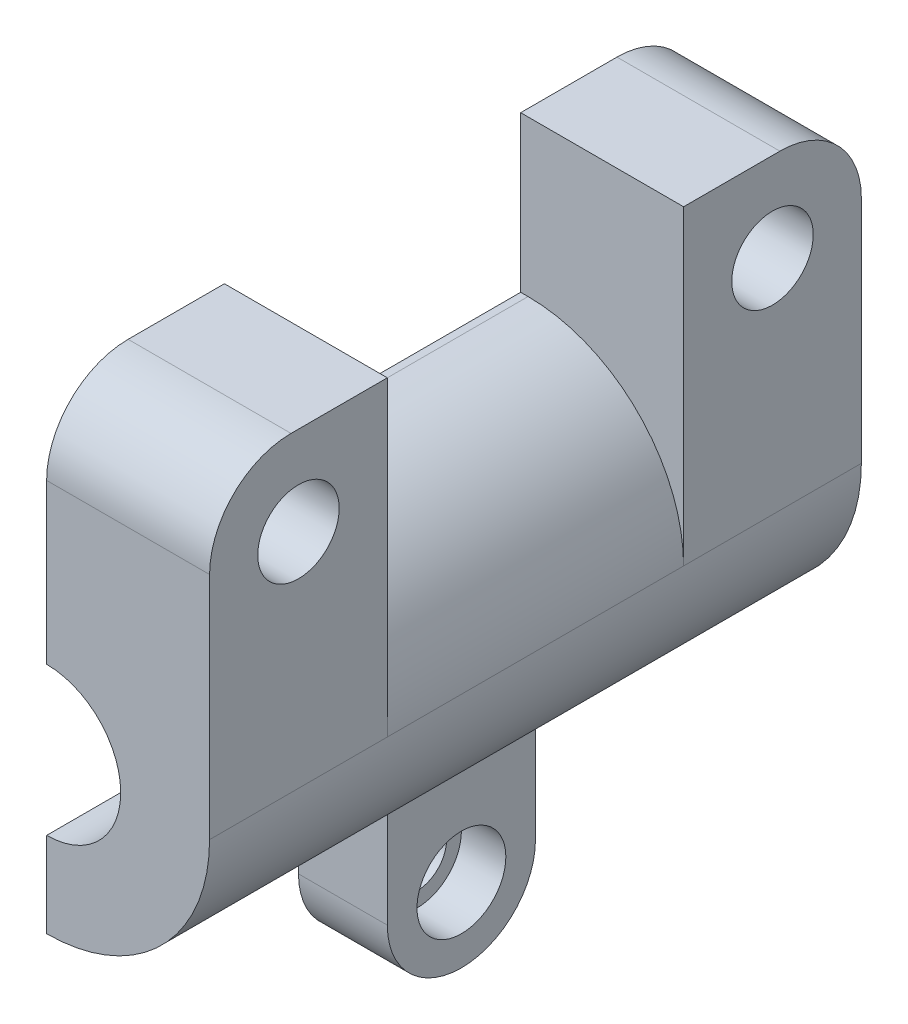
from build123d import *

# Parameters (mm, degrees)
SKETCH1_W               = 44
SKETCH1_H               = 32
BOSS_EXTRUDE1_DEPTH     = 11
SKETCH2_W               = 24.5
SKETCH2_H               = 15.5
CUT_EXTRUDE1_DEPTH      = 7.75
FILLET1_R               = 7.75
CUT_EXTRUDE2_DEPTH      = 40.370833113
CUT_EXTRUDE2_DEPTH_BACK = 40.370833113
SKETCH4_R               = 2.75
SKETCH4_W               = 20
SKETCH4_H               = 10.5
CUT_EXTRUDE3_DEPTH      = 30.342801502
FILLET4_R               = 5.5
SKETCH7_W               = 10
SKETCH7_H               = 10
SKETCH7_R               = 2
BOSS_EXTRUDE5_DEPTH     = 6
FILLET5_R               = 5
CUT_EXTRUDE7_START      = -3
SKETCH9_R               = 3
SKETCH9_R_2             = 2
CUT_EXTRUDE7_DEPTH      = 3
FILLET7_R               = 10.5
FILLET8_R               = 11


# Some blends are built 0.0001 mm under size
with BuildPart() as part:
    # Sketch1 → Boss-Extrude1 (new body)
    with BuildSketch(Plane(origin=(0, 0, 0), x_dir=(0, 0, -1), z_dir=(1, 0, 0))):
        Rectangle(SKETCH1_W, SKETCH1_H)
    extrude(amount=BOSS_EXTRUDE1_DEPTH)

    # Sketch2 → Cut-Extrude1 (cut)
    with BuildSketch(Plane(origin=(0, 0, 0), x_dir=(0, 0, -1), z_dir=(1, 0, 0))):
        with Locations((0, -5.25)):
            Rectangle(SKETCH2_W, SKETCH2_H)
    extrude(amount=CUT_EXTRUDE1_DEPTH, mode=Mode.SUBTRACT)

    # Fillet1
    fillet1_edges = [part.edges().sort_by_distance(p)[0] for p in [
        (7.75, 2.5, 0),
        (7.75, -13, 0),
    ]]
    fillet(fillet1_edges, radius=FILLET1_R - 0.0001)  # a hair under: the kernel refuses the full size

    # Sketch3 → Cut-Extrude2 (cut, two sides: drawn at the far end of the back side and taken through both)
    with BuildSketch(Plane.XY.offset(-12.25).offset(-CUT_EXTRUDE2_DEPTH_BACK)):
        with BuildLine():
            ThreePointArc((0, -10.25), (3.535533906, -8.785533906), (5, -5.25))
            ThreePointArc((5, -5.25), (3.535533906, -1.714466094), (0, -0.25))
            Line((0, -0.25), (0, -10.25))
        make_face()
        with BuildLine():
            Line((0, -10.25), (0, -0.25))
            ThreePointArc((0, -0.25), (-5, -5.25), (0, -10.25))
        make_face()
    extrude(amount=CUT_EXTRUDE2_DEPTH + CUT_EXTRUDE2_DEPTH_BACK, mode=Mode.SUBTRACT)

    # Sketch4 → Cut-Extrude3 (cut, through all)
    with BuildSketch(Plane(origin=(11, 0, 0), x_dir=(0, 0, -1), z_dir=(1, 0, 0))):
        with Locations((-16, 10)):
            Circle(SKETCH4_R)
        with Locations((16, 10)):
            Circle(SKETCH4_R)
        with Locations((0, 10.75)):
            Rectangle(SKETCH4_W, SKETCH4_H)
    extrude(amount=-CUT_EXTRUDE3_DEPTH, mode=Mode.SUBTRACT)

    # Fillet4
    fillet4_edges = [part.edges().sort_by_distance(p)[0] for p in [
        (5.5, 16, 22),
        (5.5, 16, -22),
    ]]
    fillet(fillet4_edges, radius=FILLET4_R)

    # Sketch7 → Boss-Extrude5 (add)
    with BuildSketch(Plane(origin=(0, 0, 0), x_dir=(0, 0, -1), z_dir=(1, 0, 0))):
        with Locations((0, -21)):
            Rectangle(SKETCH7_W, SKETCH7_H)
        with Locations((0, -21)):
            Circle(SKETCH7_R, mode=Mode.SUBTRACT)
    extrude(amount=BOSS_EXTRUDE5_DEPTH)

    # Fillet5
    fillet5_edges = [part.edges().sort_by_distance(p)[0] for p in [
        (3, -26, -5),
        (3, -26, 5),
    ]]
    fillet(fillet5_edges, radius=FILLET5_R - 0.0001)  # a hair under: the kernel refuses the full size

    # Sketch9 → Cut-Extrude7 (cut)
    with BuildSketch(Plane(origin=(6, 0, 0), x_dir=(0, 0, -1), z_dir=(1, 0, 0)).offset(CUT_EXTRUDE7_START)):
        with Locations((0, -21)):
            Circle(SKETCH9_R)
        with Locations((0, -21)):
            Circle(SKETCH9_R_2, mode=Mode.SUBTRACT)
    extrude(amount=CUT_EXTRUDE7_DEPTH, mode=Mode.SUBTRACT)

    # Fillet7
    fillet7_edges = [part.edges().sort_by_distance(p)[0] for p in [
        (11, 5.5, 0),
    ]]
    fillet(fillet7_edges, radius=FILLET7_R)

    # Fillet8
    # the kernel refuses this fillet: 11 mm, written as the material it takes off along each edge
    with BuildSketch(Plane(origin=(11, -16, 49.5), x_dir=(0, 1, 0), z_dir=(0, 0, -1))) as fillet8_piece_1_section:
        with BuildLine():
            CenterArc((FILLET8_R, -FILLET8_R), FILLET8_R, 90, 90)
            Line((0, -FILLET8_R), (0, 0))
            Line((0, 0), (FILLET8_R, 0))
        make_face()
    fillet8_piece_1 = extrude(amount=99, mode=Mode.PRIVATE)
    fillet8_piece_1 = split(fillet8_piece_1, bisect_by=Plane(origin=(6, -13.119412113, 27.25), z_dir=(1, 0, 0)), keep=Keep.TOP, mode=Mode.PRIVATE)
    fillet8_piece_1 = split(fillet8_piece_1, bisect_by=Plane(origin=(9.313036117, -13.119412113, 5), z_dir=(0, 0, 1)), keep=Keep.TOP, mode=Mode.PRIVATE)
    add(fillet8_piece_1, mode=Mode.SUBTRACT)
    with BuildSketch(Plane(origin=(11, -16, 49.5), x_dir=(0, 1, 0), z_dir=(0, 0, -1))) as fillet8_piece_2_section:
        with BuildLine():
            CenterArc((FILLET8_R, -FILLET8_R), FILLET8_R, 90, 90)
            Line((0, -FILLET8_R), (0, 0))
            Line((0, 0), (FILLET8_R, 0))
        make_face()
    fillet8_piece_2 = extrude(amount=99, mode=Mode.PRIVATE)
    fillet8_piece_2 = split(fillet8_piece_2, bisect_by=Plane(origin=(6, -15.650616863, 27.25), z_dir=(-1, 0, 0)), keep=Keep.TOP, mode=Mode.PRIVATE)
    fillet8_piece_2 = split(fillet8_piece_2, bisect_by=Plane(origin=(4.102097244, -15.650616863, 5), z_dir=(0, 0, 1)), keep=Keep.TOP, mode=Mode.PRIVATE)
    add(fillet8_piece_2, mode=Mode.SUBTRACT)
    with BuildSketch(Plane(origin=(11, -16, 49.5), x_dir=(0, 1, 0), z_dir=(0, 0, -1))) as fillet8_piece_3_section:
        with BuildLine():
            CenterArc((FILLET8_R, -FILLET8_R), FILLET8_R, 90, 90)
            Line((0, -FILLET8_R), (0, 0))
            Line((0, 0), (FILLET8_R, 0))
        make_face()
    fillet8_piece_3 = extrude(amount=99, mode=Mode.PRIVATE)
    fillet8_piece_3 = split(fillet8_piece_3, bisect_by=Plane(origin=(6, -13.119412113, 0), z_dir=(1, 0, 0)), keep=Keep.TOP, mode=Mode.PRIVATE)
    fillet8_piece_3 = split(fillet8_piece_3, bisect_by=Plane(origin=(9.313036117, -13.119412113, -5), z_dir=(0, 0, 1)), keep=Keep.TOP, mode=Mode.PRIVATE)
    fillet8_piece_3 = split(fillet8_piece_3, bisect_by=Plane(origin=(9.313036117, -13.119412113, 5), z_dir=(0, 0, -1)), keep=Keep.TOP, mode=Mode.PRIVATE)
    add(fillet8_piece_3, mode=Mode.SUBTRACT)
    with BuildSketch(Plane(origin=(11, -16, 49.5), x_dir=(0, 1, 0), z_dir=(0, 0, -1))) as fillet8_piece_4_section:
        with BuildLine():
            CenterArc((FILLET8_R, -FILLET8_R), FILLET8_R, 90, 90)
            Line((0, -FILLET8_R), (0, 0))
            Line((0, 0), (FILLET8_R, 0))
        make_face()
    fillet8_piece_4 = extrude(amount=99, mode=Mode.PRIVATE)
    fillet8_piece_4 = split(fillet8_piece_4, bisect_by=Plane(origin=(6, -13.119412113, -27.25), z_dir=(1, 0, 0)), keep=Keep.TOP, mode=Mode.PRIVATE)
    fillet8_piece_4 = split(fillet8_piece_4, bisect_by=Plane(origin=(9.313036117, -13.119412113, -5), z_dir=(0, 0, -1)), keep=Keep.TOP, mode=Mode.PRIVATE)
    add(fillet8_piece_4, mode=Mode.SUBTRACT)
    with BuildSketch(Plane(origin=(11, -16, 49.5), x_dir=(0, 1, 0), z_dir=(0, 0, -1))) as fillet8_piece_5_section:
        with BuildLine():
            CenterArc((FILLET8_R, -FILLET8_R), FILLET8_R, 90, 90)
            Line((0, -FILLET8_R), (0, 0))
            Line((0, 0), (FILLET8_R, 0))
        make_face()
    fillet8_piece_5 = extrude(amount=99, mode=Mode.PRIVATE)
    fillet8_piece_5 = split(fillet8_piece_5, bisect_by=Plane(origin=(6, -15.650616863, -27.25), z_dir=(-1, 0, 0)), keep=Keep.TOP, mode=Mode.PRIVATE)
    fillet8_piece_5 = split(fillet8_piece_5, bisect_by=Plane(origin=(4.102097244, -15.650616863, -5), z_dir=(0, 0, -1)), keep=Keep.TOP, mode=Mode.PRIVATE)
    add(fillet8_piece_5, mode=Mode.SUBTRACT)


solid = part.part
